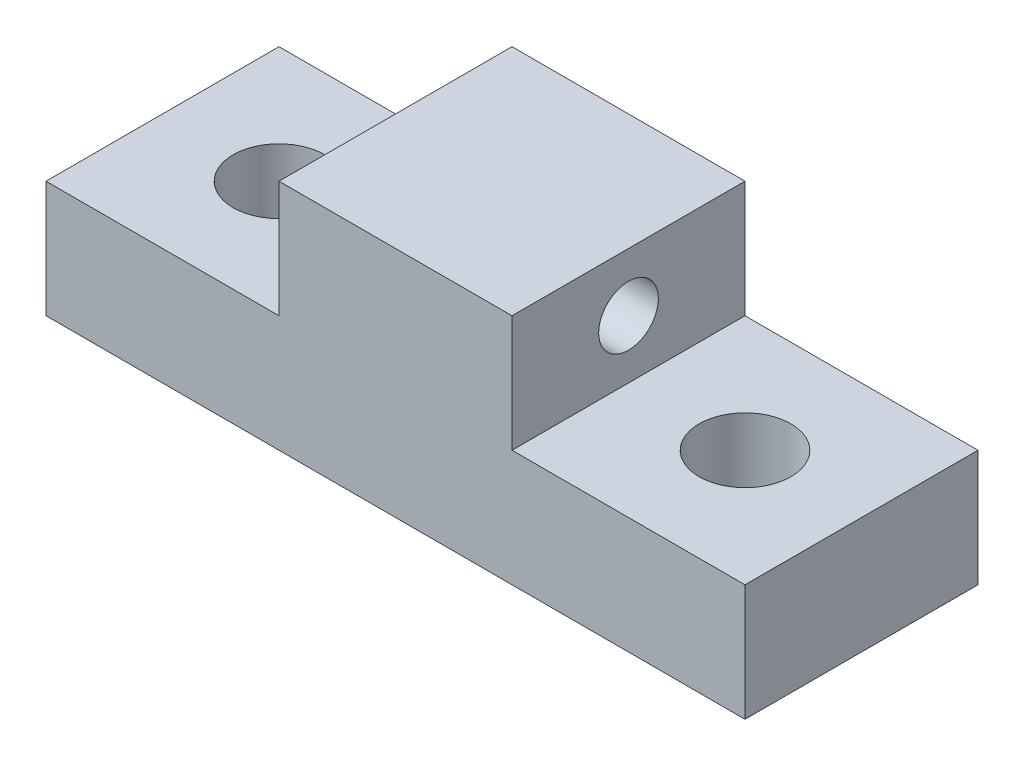
from build123d import *

# Parameters (mm, degrees)
SKETCH1_R           = 3.251199873
BOSS_EXTRUDE1_DEPTH = 12.7
SKETCH2_W           = 25.4
SKETCH2_H           = 25.4
BOSS_EXTRUDE2_DEPTH = 12.7
SKETCH3_R           = 3.251199873
CUT_EXTRUDE1_DEPTH  = 43.7
SKETCH4_R           = 5
CUT_EXTRUDE2_DEPTH  = 7.35


with BuildPart() as part:
    # Sketch1 → Boss-Extrude1 (new body)
    with BuildSketch(Plane(origin=(0, 0, 0), x_dir=(1, 0, 0), z_dir=(0, 1, 0))):
        Polygon((-38.1, 12.7), (-38.1, -12.7), (-12.7, -12.7), (38.1, -12.7), (38.1, 12.7), (-12.7, 12.7), align=None)
        with Locations((-25.4, 0)):
            Circle(SKETCH1_R, mode=Mode.SUBTRACT)
        with Locations((25.4, 0)):
            Circle(SKETCH1_R, mode=Mode.SUBTRACT)
    extrude(amount=BOSS_EXTRUDE1_DEPTH)

    # Sketch2 → Boss-Extrude2 (add)
    with BuildSketch(Plane(origin=(0, 12.7, 0), x_dir=(1, 0, 0), z_dir=(0, 1, 0))):
        Rectangle(SKETCH2_W, SKETCH2_H)
    extrude(amount=BOSS_EXTRUDE2_DEPTH)

    # Sketch3 → Cut-Extrude1 (cut)
    with BuildSketch(Plane.ZY.offset(12.7)):
        with Locations((0, 19.05)):
            Circle(SKETCH3_R)
    extrude(amount=-CUT_EXTRUDE1_DEPTH, mode=Mode.SUBTRACT)

    # Sketch4 → Cut-Extrude2 (cut)
    with BuildSketch(Plane(origin=(0, 12.7, 0), x_dir=(1, 0, 0), z_dir=(0, 1, 0))):
        with Locations((-25.4, 0)):
            Circle(SKETCH4_R)
        with Locations((25.4, 0)):
            Circle(SKETCH4_R)
    extrude(amount=-CUT_EXTRUDE2_DEPTH, mode=Mode.SUBTRACT)


solid = part.part
